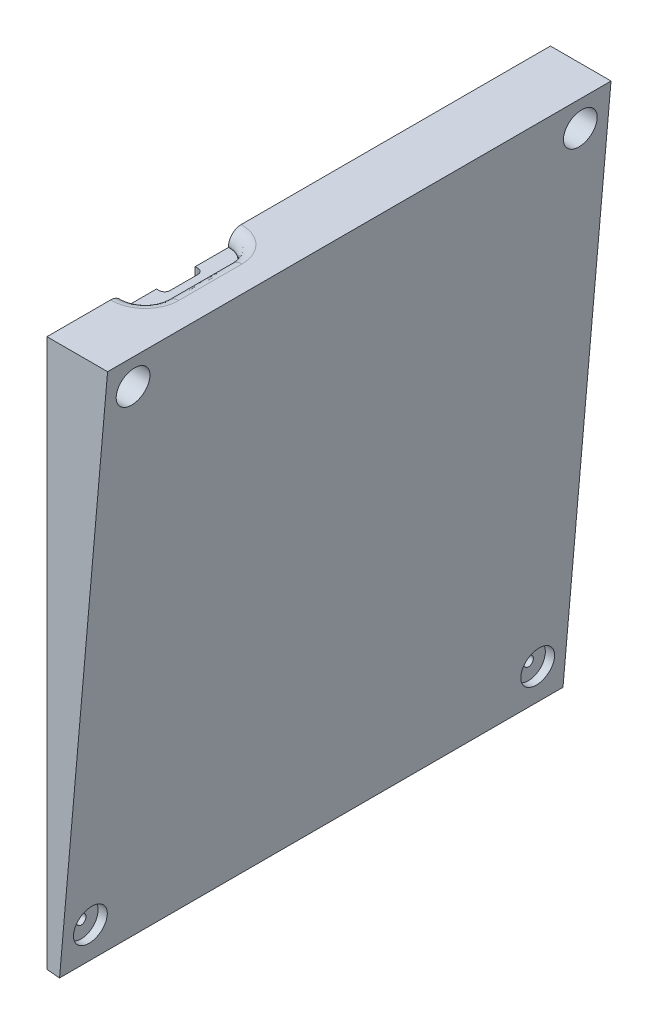
from build123d import *

# Parameters (mm, degrees)
BOSS_EXTRUDE1_DEPTH       = 119.57
CUT_EXTRUDE1_START        = -114.274828565
CUT_EXTRUDE1_DEPTH        = 109.036999581
BOSS_EXTRUDE2_OUTLINE_R   = 1.15
BOSS_EXTRUDE2_DEPTH       = 12
BOSS_EXTRUDE2_2_OUTLINE_W = 8
BOSS_EXTRUDE2_2_OUTLINE_H = 109.036999581
BOSS_EXTRUDE2_2_OUTLINE_R = 1.15
BOSS_EXTRUDE2_2_DEPTH     = 1.246713455
BOSS_EXTRUDE4_START       = -114.274828565
BOSS_EXTRUDE4_DEPTH       = 85.567402499
BOSS_EXTRUDE4_START_2     = -33.707426066
BOSS_EXTRUDE4_2_DEPTH     = 5
CHAMFER6_SIZE             = 2
CHAMFER7_SIZE             = 3
CHAMFER8_SIZE             = 3
SKETCH10_R                = 1.15
CUT_EXTRUDE2_DEPTH        = 40
CUT_EXTRUDE5_START        = -2
SKETCH11_R                = 4
CUT_EXTRUDE5_DEPTH        = 29
CUT_EXTRUDE6_START        = -1.5
SKETCH14_R                = 4
CUT_EXTRUDE6_DEPTH        = 29
CUT_EXTRUDE8_DEPTH        = 21
CUT_EXTRUDE9_DEPTH        = 3.2
FILLET2_SIZE              = 3
CUT_EXTRUDE11_REACH       = 276.65
SKETCH17_W                = 2
SKETCH17_H                = 109.036999581


with BuildPart() as part:
    # Sketch1 → Boss-Extrude1 (new body)
    with BuildSketch(Plane.XY):
        Polygon((3, -246.574899039), (5.988584094, -246.836366267), (17.398099188, -116.425012), (3, -116.425012), align=None)
    extrude(amount=-BOSS_EXTRUDE1_DEPTH)

    # Cut-Extrude1: read off the stored shape, not the designer's step
    # Cut-Extrude1 outline → Cut-Extrude1 (cut)
    with BuildSketch(Plane.XY.offset(CUT_EXTRUDE1_START)):
        Polygon((3, -240.324899039), (3.546804147, -240.324899039), (13.928199078, -121.665012), (3, -121.665012), align=None)
    extrude(amount=CUT_EXTRUDE1_DEPTH, mode=Mode.SUBTRACT)

    # Boss-Extrude2: read off the stored shape, not the designer's step
    # Boss-Extrude2 outline → Boss-Extrude2 (add)
    # profile 1 of 2: a face of its own
    with BuildSketch(Plane.YZ.offset(3)):
        with BuildLine():
            ThreePointArc((-121.665012, -105.274828565), (-128.028973031, -107.910867534), (-130.665012, -114.274828565))
            Line((-130.665012, -114.274828565), (-121.665012, -114.274828565))
            Line((-121.665012, -114.274828565), (-121.665012, -105.274828565))
        make_face()
        with Locations((-123.097401734, -112.861435085)):
            Circle(BOSS_EXTRUDE2_OUTLINE_R, mode=Mode.SUBTRACT)
    # profile 2 of 2: a face of its own
    with BuildSketch(Plane.YZ.offset(3)):
        with BuildLine():
            ThreePointArc((-130.665012, -5.237828984), (-128.02897303, -11.601790014), (-121.665012, -14.237828984))
            Line((-121.665012, -14.237828984), (-121.665012, -5.237828984))
            Line((-121.665012, -5.237828984), (-130.665012, -5.237828984))
        make_face()
        with Locations((-123.076755271, -6.637532276)):
            Circle(BOSS_EXTRUDE2_OUTLINE_R, mode=Mode.SUBTRACT)
    extrude(amount=BOSS_EXTRUDE2_DEPTH)

    # Boss-Extrude2 2 outline → Boss-Extrude2 2 (add)
    with BuildSketch(Plane.YZ.offset(3)):
        with Locations((-236.324899039, -59.756328775)):
            Rectangle(BOSS_EXTRUDE2_2_OUTLINE_W, BOSS_EXTRUDE2_2_OUTLINE_H)
        with Locations((-238.852206599, -112.861435085)):
            Circle(BOSS_EXTRUDE2_2_OUTLINE_R, mode=Mode.SUBTRACT)
        with Locations((-238.852206599, -6.631689226)):
            Circle(BOSS_EXTRUDE2_2_OUTLINE_R, mode=Mode.SUBTRACT)
    extrude(amount=BOSS_EXTRUDE2_2_DEPTH)

    # Boss-Extrude4: read off the stored shape, not the designer's step
    # Boss-Extrude4 outline → Boss-Extrude4 (add)
    with BuildSketch(Plane.XY.offset(BOSS_EXTRUDE4_START)):
        Polygon((10.373859962, -162.291294), (1.63, -161.526305378), (1.63, -164.53776489), (10.112392734, -165.279878094), align=None)
        Polygon((8.762077136, -180.714056005), (1.63, -180.090080109), (1.63, -183.101539621), (8.500609907, -183.7026401), align=None)
    extrude(amount=BOSS_EXTRUDE4_DEPTH)

    # Boss-Extrude4 2 outline → Boss-Extrude4 2 (add)
    with BuildSketch(Plane.XY.offset(BOSS_EXTRUDE4_START_2)):
        Polygon((11.942877213, -144.35734476), (1.63, -143.455084916), (1.63, -161.526305378), (10.373859962, -162.291294), align=None)
        Polygon((10.112392734, -165.279878094), (1.63, -164.53776489), (1.63, -180.090080109), (8.762077136, -180.714056005), align=None)
        Polygon((8.500609907, -183.7026401), (1.63, -183.101539621), (1.63, -188.626977605), (8.020868789, -189.186106174), align=None)
    extrude(amount=BOSS_EXTRUDE4_2_DEPTH)

    # Chamfer6
    # the kernel refuses this chamfer: 2 mm, written as the material it takes off along each edge
    with BuildSketch(Plane(origin=(1.63, -174.946714133, -114.274828565), x_dir=(0, 0, 1), z_dir=(0, -1, 0))) as chamfer6_piece_1_section:
        Polygon((CHAMFER6_SIZE, 0), (0, -CHAMFER6_SIZE), (0, 0), align=None)
    chamfer6_piece_1 = extrude(amount=13.298191464, mode=Mode.PRIVATE)
    chamfer6_piece_1 = split(chamfer6_piece_1, bisect_by=Plane(origin=(3, -174.946714133, -114.274828565), z_dir=(-1, 0, 0)), keep=Keep.TOP, mode=Mode.PRIVATE)
    add(chamfer6_piece_1, mode=Mode.SUBTRACT)
    with BuildSketch(Plane(origin=(1.63, -156.382939402, -114.274828565), x_dir=(0, 0, 1), z_dir=(0, -1, 0))) as chamfer6_piece_2_section:
        Polygon((CHAMFER6_SIZE, 0), (0, -CHAMFER6_SIZE), (0, 0), align=None)
    chamfer6_piece_2 = extrude(amount=13.298191464, mode=Mode.PRIVATE)
    chamfer6_piece_2 = split(chamfer6_piece_2, bisect_by=Plane(origin=(3, -156.382939402, -114.274828565), z_dir=(-1, 0, 0)), keep=Keep.TOP, mode=Mode.PRIVATE)
    add(chamfer6_piece_2, mode=Mode.SUBTRACT)

    # Chamfer7
    chamfer7_edges = [part.edges().sort_by_distance(p)[0] for p in [
        (10.112392734, -165.279878094, -73.991127315),
        (8.762077136, -180.714056005, -73.991127315),
        (9.437234935, -172.99696705, -33.707426066),
        (9.437234935, -172.996967049, -114.274828565),
    ]]
    chamfer(chamfer7_edges, length=CHAMFER7_SIZE)

    # Chamfer8
    chamfer8_edges = [part.edges().sort_by_distance(p)[0] for p in [
        (8.500609907, -183.7026401, -73.991127315),
        (10.373859962, -162.291294, -73.991127315),
    ]]
    chamfer(chamfer8_edges, length=CHAMFER8_SIZE)

    # Sketch10 → Cut-Extrude2 (cut)
    with BuildSketch(Plane(origin=(3, 0, 0), x_dir=(0, -1, 0), z_dir=(-1, 0, 0))):
        with Locations((123.097401734, -112.861435085)):
            Circle(SKETCH10_R)
        with Locations((123.076755271, -6.637532276)):
            Circle(SKETCH10_R)
        with Locations((238.852206599, -6.631689226)):
            Circle(SKETCH10_R)
        with Locations((238.852206599, -112.861435085)):
            Circle(SKETCH10_R)
    extrude(amount=-CUT_EXTRUDE2_DEPTH, mode=Mode.SUBTRACT)

    # Sketch11 → Cut-Extrude5 (cut)
    with BuildSketch(Plane(origin=(3, 0, 0), x_dir=(0, -1, 0), z_dir=(-1, 0, 0)).offset(CUT_EXTRUDE5_START)):
        with Locations((123.097401734, -112.861435085)):
            Circle(SKETCH11_R)
        with Locations((123.076755271, -6.637532276)):
            Circle(SKETCH11_R)
    extrude(amount=-CUT_EXTRUDE5_DEPTH, mode=Mode.SUBTRACT)

    # Sketch14 → Cut-Extrude6 (cut)
    with BuildSketch(Plane(origin=(3, 0, 0), x_dir=(0, -1, 0), z_dir=(-1, 0, 0)).offset(CUT_EXTRUDE6_START)):
        with Locations((238.852206599, -6.631689226)):
            Circle(SKETCH14_R)
        with Locations((238.852206599, -112.861435085)):
            Circle(SKETCH14_R)
    extrude(amount=-CUT_EXTRUDE6_DEPTH, mode=Mode.SUBTRACT)

    # Sketch15 → Cut-Extrude8 (cut)
    with BuildSketch(Plane(origin=(0, -116.425012, 0), x_dir=(-1, 0, 0), z_dir=(0, 1, 0))):
        with BuildLine():
            Line((-3.623758546, -26.015341992), (-2.783758546, -26.015341992))
            ThreePointArc((-2.783758546, -26.015341992), (-1.864519731, -26.396103177), (-1.483758546, -27.315341992))
            Line((-1.483758546, -27.315341992), (-1.483758546, -33.915341992))
            ThreePointArc((-1.483758546, -33.915341992), (-1.864519731, -34.834580808), (-2.783758546, -35.215341992))
            Line((-2.783758546, -35.215341992), (-3.623758546, -35.215341992))
            ThreePointArc((-3.623758546, -35.215341992), (-4.542997362, -34.834580808), (-4.923758546, -33.915341992))
            Line((-4.923758546, -33.915341992), (-4.923758546, -27.315341992))
            ThreePointArc((-4.923758546, -27.315341992), (-4.542997362, -26.396103177), (-3.623758546, -26.015341992))
        make_face()
    extrude(amount=-CUT_EXTRUDE8_DEPTH, mode=Mode.SUBTRACT)

    # Sketch16 → Cut-Extrude9 (cut)
    with BuildSketch(Plane(origin=(0, -116.425012, 0), x_dir=(-1, 0, 0), z_dir=(0, 1, 0))):
        with BuildLine():
            Line((-8.203758546, -38.115341992), (-8.203758546, -23.115341992))
            ThreePointArc((-8.203758546, -23.115341992), (-3.203758546, -18.115341992), (1.796241454, -23.115341992))
            Line((1.796241454, -23.115341992), (1.796241454, -38.115341992))
            ThreePointArc((1.796241454, -38.115341992), (-3.203758546, -43.115341992), (-8.203758546, -38.115341992))
        make_face()
    extrude(amount=-CUT_EXTRUDE9_DEPTH, mode=Mode.SUBTRACT)

    # Fillet2
    # a fillet whose section is not a circle: 3 mm, written as the material it takes off along each edge
    with BuildSketch(Plane(origin=(3.203758546, -116.425012, -23.115341992), x_dir=(1, 0, 0), z_dir=(0, 0, -1))) as fillet2_piece_1:
        with BuildLine():
            Bezier((5 + FILLET2_SIZE, 0), (5, 0), (5, FILLET2_SIZE), weights=[1, 0.707106781, 1])
            Line((5, FILLET2_SIZE), (5, 0))
            Line((5, 0), (5 + FILLET2_SIZE, 0))
        make_face()
    revolve(axis=Axis((3.203758546, -116.425012, -23.115341992), (0, -1, 0)), revolution_arc=178.315556871, mode=Mode.SUBTRACT)
    with BuildSketch(Plane(origin=(8.203758546, -116.425012, -38.115341992), x_dir=(1, 0, 0), z_dir=(0, 0, 1))) as fillet2_piece_2:
        with BuildLine():
            Bezier((FILLET2_SIZE, 0), (0, 0), (0, -FILLET2_SIZE), weights=[1, 0.707106781, 1])
            Line((0, -FILLET2_SIZE), (0, 0))
            Line((0, 0), (FILLET2_SIZE, 0))
        make_face()
    extrude(amount=15, mode=Mode.SUBTRACT)
    with BuildSketch(Plane(origin=(3.203758546, -116.425012, -38.115341992), x_dir=(-0.9995678782122136, 0, -0.02939484387325848), z_dir=(-0.02939484387325848, 0, 0.9995678782122136))) as fillet2_piece_3:
        with BuildLine():
            Bezier((5 + FILLET2_SIZE, 0), (5, 0), (5, FILLET2_SIZE), weights=[1, 0.707106781, 1])
            Line((5, FILLET2_SIZE), (5, 0))
            Line((5, 0), (5 + FILLET2_SIZE, 0))
        make_face()
    revolve(axis=Axis((3.203758546, -116.425012, -38.115341992), (0, -1, 0)), revolution_arc=178.315556871, mode=Mode.SUBTRACT)

    # Cut-Extrude11: up to this plane
    cut_extrude11_end = Plane(origin=(2.988584094, -246.836366267, -119.57), z_dir=(0.9961946980917459, -0.08715574274765435, 0))
    # Sketch17 → Cut-Extrude11 (cut, up to the surface)
    with BuildSketch(Plane(origin=(3, 0, 0), x_dir=(0, -1, 0), z_dir=(-1, 0, 0)), mode=Mode.PRIVATE) as cut_extrude11_sk1:
        with Locations((233.324899039, -59.756328775)):
            Rectangle(SKETCH17_W, SKETCH17_H)
    cut_extrude11_tool1 = split(extrude(cut_extrude11_sk1.sketch, amount=-CUT_EXTRUDE11_REACH, mode=Mode.PRIVATE), bisect_by=cut_extrude11_end, keep=Keep.BOTH, mode=Mode.PRIVATE)
    add(cut_extrude11_tool1.solids().sort_by_distance((3, -233.324899, -59.756329))[0], mode=Mode.SUBTRACT)


solid = part.part
